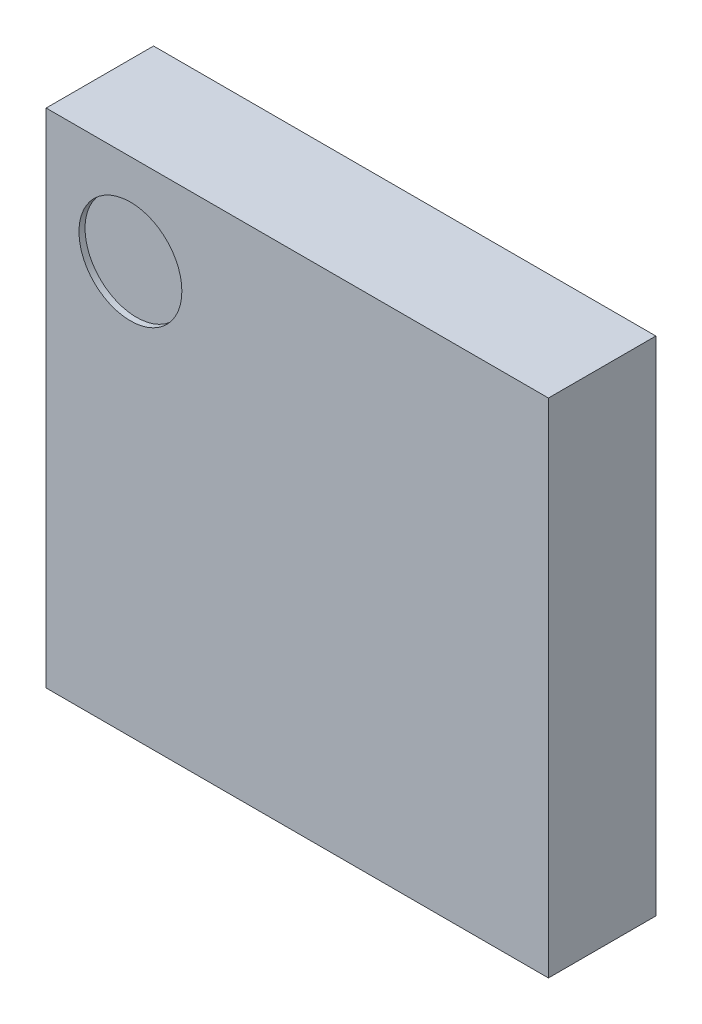
from build123d import *

# Parameters (mm, degrees)
SKETCH1_W           = 1.66
SKETCH1_H           = 1.66
BOSS_EXTRUDE1_DEPTH = 0.355
LPATTERN1_COUNT     = 2
LPATTERN1_PITCH     = 0.5
LPATTERN1_COL_COUNT = 2
LPATTERN1_COL_PITCH = 0.5
SKETCH3_R           = 0.170011755
CUT_EXTRUDE1_DEPTH  = 0.02


with BuildPart() as part:
    # Sketch1 → Boss-Extrude1 (new body)
    with BuildSketch(Plane.XY):
        Rectangle(SKETCH1_W, SKETCH1_H)
    extrude(amount=BOSS_EXTRUDE1_DEPTH)

    # Sketch2 → Revolve1 (revolve)
    with BuildSketch(Plane(origin=(0, 0, 0), x_dir=(1, 0, 0), z_dir=(0, 1, 0))):
        with BuildLine():
            Line((0, 0.2), (0, 0))
            Line((0, 0), (0.111355287, 0))
            ThreePointArc((0.111355287, 0), (0.114455231, 0.132725976), (0, 0.2))
        make_face()
    revolve1 = revolve(axis=Axis((0, 0, 0), (0, 0, -1)))

    # LPattern1: Revolve1 ×2
    with Locations(*[(0, i * LPATTERN1_PITCH, 0) for i in range(1, LPATTERN1_COUNT)]):
        add(revolve1)

    # LPattern1 col: Revolve1 ×2
    with Locations(*[(0, -i * LPATTERN1_COL_PITCH, 0) for i in range(1, LPATTERN1_COL_COUNT)]):
        add(revolve1)

    # LPattern2 copy 1 sketch → LPattern2 copy 1 (revolve)
    with BuildSketch(Plane(origin=(0.5, 0.5, 0), x_dir=(1, 0, 0), z_dir=(0, 1, 0))):
        with BuildLine():
            Line((0, 0.2), (0, 0))
            Line((0, 0), (0.111355287, 0))
            ThreePointArc((0.111355287, 0), (0.114455231, 0.132725976), (0, 0.2))
        make_face()
    revolve(axis=Axis((0.5, 0.5, 0), (0, 0, -1)))

    # LPattern2 copy 2 sketch → LPattern2 copy 2 (revolve)
    with BuildSketch(Plane(origin=(0.5, -0.5, 0), x_dir=(1, 0, 0), z_dir=(0, 1, 0))):
        with BuildLine():
            Line((0, 0.2), (0, 0))
            Line((0, 0), (0.111355287, 0))
            ThreePointArc((0.111355287, 0), (0.114455231, 0.132725976), (0, 0.2))
        make_face()
    revolve(axis=Axis((0.5, -0.5, 0), (0, 0, -1)))

    # LPattern2 copy 3 sketch → LPattern2 copy 3 (revolve)
    with BuildSketch(Plane(origin=(0.5, 0, 0), x_dir=(1, 0, 0), z_dir=(0, 1, 0))):
        with BuildLine():
            Line((0, 0.2), (0, 0))
            Line((0, 0), (0.111355287, 0))
            ThreePointArc((0.111355287, 0), (0.114455231, 0.132725976), (0, 0.2))
        make_face()
    revolve(axis=Axis((0.5, 0, 0), (0, 0, -1)))

    # LPattern3 copy 1 sketch → LPattern3 copy 1 (revolve)
    with BuildSketch(Plane(origin=(-0.5, 0.5, 0), x_dir=(1, 0, 0), z_dir=(0, 1, 0))):
        with BuildLine():
            Line((0, 0.2), (0, 0))
            Line((0, 0), (0.111355287, 0))
            ThreePointArc((0.111355287, 0), (0.114455231, 0.132725976), (0, 0.2))
        make_face()
    revolve(axis=Axis((-0.5, 0.5, 0), (0, 0, -1)))

    # LPattern3 copy 2 sketch → LPattern3 copy 2 (revolve)
    with BuildSketch(Plane(origin=(-0.5, -0.5, 0), x_dir=(1, 0, 0), z_dir=(0, 1, 0))):
        with BuildLine():
            Line((0, 0.2), (0, 0))
            Line((0, 0), (0.111355287, 0))
            ThreePointArc((0.111355287, 0), (0.114455231, 0.132725976), (0, 0.2))
        make_face()
    revolve(axis=Axis((-0.5, -0.5, 0), (0, 0, -1)))

    # LPattern3 copy 3 sketch → LPattern3 copy 3 (revolve)
    with BuildSketch(Plane(origin=(-0.5, 0, 0), x_dir=(1, 0, 0), z_dir=(0, 1, 0))):
        with BuildLine():
            Line((0, 0.2), (0, 0))
            Line((0, 0), (0.111355287, 0))
            ThreePointArc((0.111355287, 0), (0.114455231, 0.132725976), (0, 0.2))
        make_face()
    revolve(axis=Axis((-0.5, 0, 0), (0, 0, -1)))

    # Sketch3 → Cut-Extrude1 (cut)
    with BuildSketch(Plane.XY.offset(0.355)):
        with Locations((-0.551497324, 0.530141066)):
            Circle(SKETCH3_R)
    extrude(amount=-CUT_EXTRUDE1_DEPTH, mode=Mode.SUBTRACT)


solid = part.part
